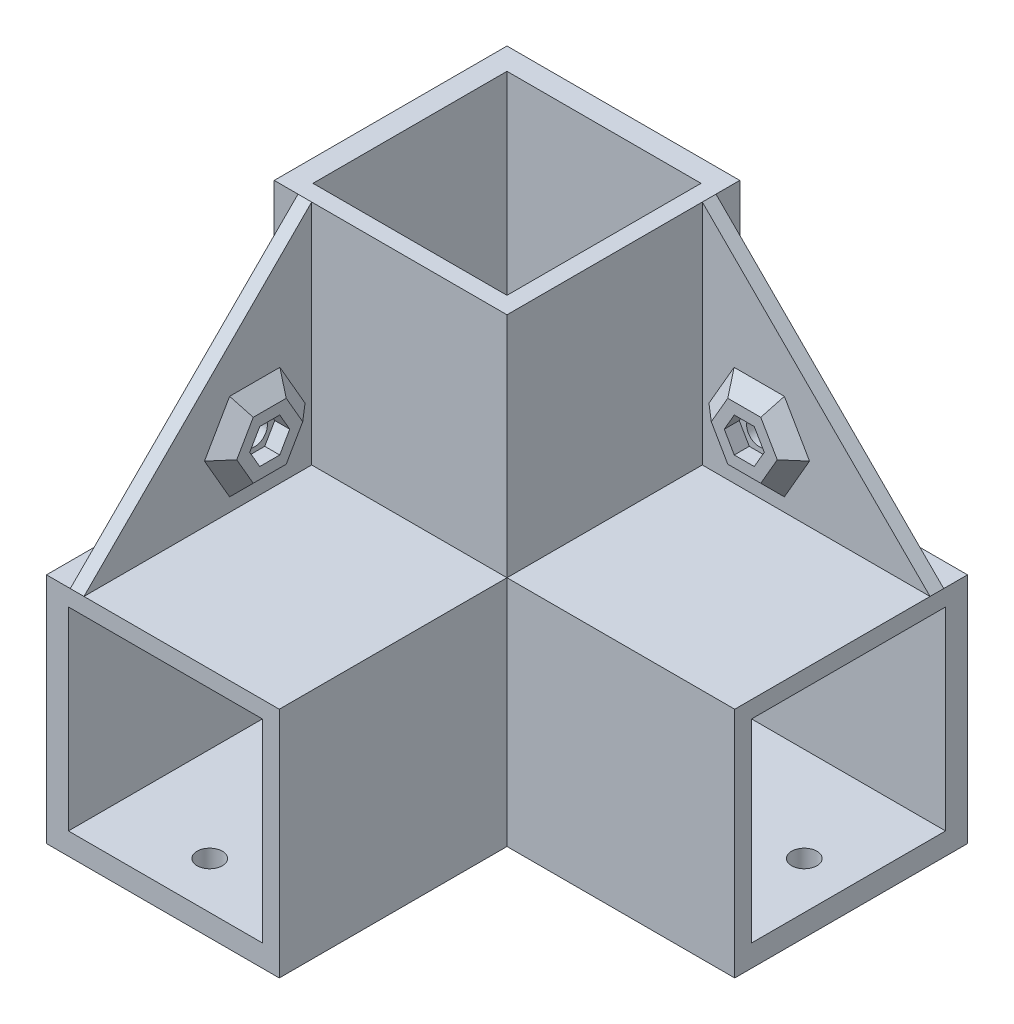
from build123d import *

# Parameters (mm, degrees)
ESQUISSE1_W                                       = 121.6
ESQUISSE1_H                                       = 121.6
BOSS_EXTRU_1_DEPTH                                = 60.8
ESQUISSE2_W                                       = 60.8
ESQUISSE2_H                                       = 60.8
ENL_V_MAT_EXTRU_1_DEPTH                           = 149.928976361
ESQUISSE3_W                                       = 60.8
ESQUISSE3_H                                       = 60.8
ENL_V_MAT_EXTRU_2_DEPTH                           = 106.3086891
ESQUISSE4_W                                       = 60.8
ESQUISSE4_H                                       = 60.8
ENL_V_MAT_EXTRU_3_DEPTH                           = 106.3086891
ESQUISSE5_W                                       = 51.8
ESQUISSE5_H                                       = 51.8
ENL_V_MAT_EXTRU_4_DEPTH                           = 60.8
ESQUISSE6_W                                       = 51.8
ESQUISSE6_H                                       = 51.8
ENL_V_MAT_EXTRU_5_DEPTH                           = 60.8
ESQUISSE7_W                                       = 51.8
ESQUISSE7_H                                       = 51.8
ENL_V_MAT_EXTRU_6_DEPTH                           = 60.8
BOSS_EXTRU_8_DEPTH                                = 1.35
BOSS_EXTRU_9_DEPTH                                = 1.35
FRAISAGE_POUR_VIS_T_TE_FRAIS_E_BOMB_E_D           = 4.3053
FRAISAGE_POUR_VIS_T_TE_FRAIS_E_BOMB_E_DEPTH       = 20
FRAISAGE_POUR_VIS_T_TE_FRAIS_E_BOMB_E_CSINK_D     = 7.0866
FRAISAGE_POUR_VIS_T_TE_FRAIS_E_BOMB_E_CSINK_ANGLE = 82
FRAISAGE_POUR_VIS_T_TE_FRAIS_E_BOMB_E_TIP         = 1.293442612
FRAISAGE_POUR_VIS_T_TE_FRAIS_E_6_PAN_D            = 4.3053
FRAISAGE_POUR_VIS_T_TE_FRAIS_E_6_PAN_DEPTH        = 20
FRAISAGE_POUR_VIS_T_TE_FRAIS_E_6_PAN_CSINK_D      = 7.7978
FRAISAGE_POUR_VIS_T_TE_FRAIS_E_6_PAN_CSINK_ANGLE  = 82
FRAISAGE_POUR_VIS_T_TE_FRAIS_E_6_PAN_TIP          = 1.293442612
BOSS_EXTRU_3_DEPTH                                = 10
ENL_V_MAT_EXTRU_13_DEPTH                          = 6.35
BOSS_EXTRU_2_DEPTH                                = 10
ENL_V_MAT_EXTRU_12_DEPTH                          = 6.35
D_GAGEMENT_1_42_D                                 = 6.7564
D_GAGEMENT_1_42_DEPTH                             = 20
D_GAGEMENT_1_42_TIP                               = 2.029827343
D_GAGEMENT_1_43_D                                 = 6.7564
D_GAGEMENT_1_43_DEPTH                             = 20
D_GAGEMENT_1_43_TIP                               = 2.029827343
BOSS_EXTRU_5_DEPTH                                = 4
CHANFREIN3_SIZE                                   = 4
BOSS_EXTRU_6_DEPTH                                = 4
CHANFREIN4_SIZE                                   = 4
BOSS_EXTRU_7_DEPTH                                = 1.35
D_GAGEMENT_1_44_D                                 = 6.7564
D_GAGEMENT_1_44_DEPTH                             = 20
D_GAGEMENT_1_44_TIP                               = 2.029827343
CHANFREIN1_START                                  = -109
CHANFREIN1_OUTLINE_W                              = 76
CHANFREIN1_OUTLINE_H                              = 88
CHANFREIN1_DEPTH                                  = 35.994058461


with BuildPart() as part:
    # Esquisse1 → Boss.-Extru.1 (new, symmetric)
    with BuildSketch(Plane.XY):
        Rectangle(ESQUISSE1_W, ESQUISSE1_H)
    extrude(amount=BOSS_EXTRU_1_DEPTH, both=True)

    # Esquisse2 → Enlèv. mat.-Extru.1 (cut, through all)
    with BuildSketch(Plane.XY.offset(60.8)):
        with Locations((30.4, 30.4)):
            Rectangle(ESQUISSE2_W, ESQUISSE2_H)
    extrude(amount=-ENL_V_MAT_EXTRU_1_DEPTH, mode=Mode.SUBTRACT)

    # Esquisse3 → Enlèv. mat.-Extru.2 (cut, through all)
    with BuildSketch(Plane(origin=(0, 0, 0), x_dir=(0, 0, -1), z_dir=(1, 0, 0))):
        with Locations((-30.4, 30.4)):
            Rectangle(ESQUISSE3_W, ESQUISSE3_H)
    extrude(amount=-ENL_V_MAT_EXTRU_2_DEPTH, mode=Mode.SUBTRACT)

    # Esquisse4 → Enlèv. mat.-Extru.3 (cut, through all)
    with BuildSketch(Plane(origin=(0, 0, 0), x_dir=(1, 0, 0), z_dir=(0, 1, 0))):
        with Locations((30.4, -30.4)):
            Rectangle(ESQUISSE4_W, ESQUISSE4_H)
    extrude(amount=-ENL_V_MAT_EXTRU_3_DEPTH, mode=Mode.SUBTRACT)

    # Esquisse5 → Enlèv. mat.-Extru.4 (cut)
    with BuildSketch(Plane.XY.offset(60.8)):
        with Locations((-30.4, -30.4)):
            Rectangle(ESQUISSE5_W, ESQUISSE5_H)
    extrude(amount=-ENL_V_MAT_EXTRU_4_DEPTH, mode=Mode.SUBTRACT)

    # Esquisse6 → Enlèv. mat.-Extru.5 (cut)
    with BuildSketch(Plane(origin=(60.8, 0, 0), x_dir=(0, 0, -1), z_dir=(1, 0, 0))):
        with Locations((30.4, -30.4)):
            Rectangle(ESQUISSE6_W, ESQUISSE6_H)
    extrude(amount=-ENL_V_MAT_EXTRU_5_DEPTH, mode=Mode.SUBTRACT)

    # Esquisse7 → Enlèv. mat.-Extru.6 (cut)
    with BuildSketch(Plane(origin=(0, 60.8, 0), x_dir=(1, 0, 0), z_dir=(0, 1, 0))):
        with Locations((-30.4, 30.4)):
            Rectangle(ESQUISSE7_W, ESQUISSE7_H)
    extrude(amount=-ENL_V_MAT_EXTRU_6_DEPTH, mode=Mode.SUBTRACT)

    # Esquisse40 → Boss.-Extru.8 (add)
    with BuildSketch(Plane.ZY.offset(60.8)):
        Polygon((0, 0), (0, 60.8), (-60.8, 60.8), (-60.8, -60.8), (60.8, -60.8), (60.8, 0), align=None)
    extrude(amount=BOSS_EXTRU_8_DEPTH)

    # Esquisse41 → Boss.-Extru.9 (add)
    with BuildSketch(Plane(origin=(0, 0, -60.8), x_dir=(-1, 0, 0), z_dir=(0, 0, -1))):
        Polygon((0, 0), (-60.8, 0), (-60.8, -60.8), (62.15, -60.8), (62.15, 60.8), (0, 60.8), align=None)
    extrude(amount=BOSS_EXTRU_9_DEPTH)

    # Fraisage pour vis à tête fraisée bombée #61
    with Locations(Plane(origin=(0, 0, -62.15), x_dir=(-1, 0, 0), z_dir=(0, 0, -1))):
        with Locations((-30.4, -30.4), (30.4, 30.4)):
            CounterSinkHole(FRAISAGE_POUR_VIS_T_TE_FRAIS_E_BOMB_E_D / 2, FRAISAGE_POUR_VIS_T_TE_FRAIS_E_BOMB_E_CSINK_D / 2, depth=FRAISAGE_POUR_VIS_T_TE_FRAIS_E_BOMB_E_DEPTH, counter_sink_angle=FRAISAGE_POUR_VIS_T_TE_FRAIS_E_BOMB_E_CSINK_ANGLE)
            with Locations((0, 0, -(FRAISAGE_POUR_VIS_T_TE_FRAIS_E_BOMB_E_DEPTH + FRAISAGE_POUR_VIS_T_TE_FRAIS_E_BOMB_E_TIP / 2))):  # 118° drill point
                Cone(0, FRAISAGE_POUR_VIS_T_TE_FRAIS_E_BOMB_E_D / 2, FRAISAGE_POUR_VIS_T_TE_FRAIS_E_BOMB_E_TIP, mode=Mode.SUBTRACT)

    # Fraisage pour vis à tête fraisée à 6 pans creux #61
    with Locations(Plane.ZY.offset(62.15)):
        with Locations((30.4, -30.4), (-30.4, 30.4)):
            CounterSinkHole(FRAISAGE_POUR_VIS_T_TE_FRAIS_E_6_PAN_D / 2, FRAISAGE_POUR_VIS_T_TE_FRAIS_E_6_PAN_CSINK_D / 2, depth=FRAISAGE_POUR_VIS_T_TE_FRAIS_E_6_PAN_DEPTH, counter_sink_angle=FRAISAGE_POUR_VIS_T_TE_FRAIS_E_6_PAN_CSINK_ANGLE)
            with Locations((0, 0, -(FRAISAGE_POUR_VIS_T_TE_FRAIS_E_6_PAN_DEPTH + FRAISAGE_POUR_VIS_T_TE_FRAIS_E_6_PAN_TIP / 2))):  # 118° drill point
                Cone(0, FRAISAGE_POUR_VIS_T_TE_FRAIS_E_6_PAN_D / 2, FRAISAGE_POUR_VIS_T_TE_FRAIS_E_6_PAN_TIP, mode=Mode.SUBTRACT)

    # Esquisse21 → Boss.-Extru.3 (add)
    with BuildSketch(Plane(origin=(0, 0, -62.15), x_dir=(-1, 0, 0), z_dir=(0, 0, -1))):
        Polygon((0, 0), (-60.8, 0), (0, 60.8), align=None)
    extrude(amount=-BOSS_EXTRU_3_DEPTH)

    # Esquisse31 → Enlèv. mat.-Extru.13 (cut)
    with BuildSketch(Plane(origin=(0, 0, -62.15), x_dir=(-1, 0, 0), z_dir=(0, 0, -1))):
        Polygon((0, 60.8), (0, 0), (-60.8, 0), align=None)
    extrude(amount=-ENL_V_MAT_EXTRU_13_DEPTH, mode=Mode.SUBTRACT)

    # Esquisse17 → Boss.-Extru.2 (add)
    with BuildSketch(Plane.ZY.offset(62.15)):
        Polygon((0, 0), (60.8, 0), (0, 60.8), align=None)
    extrude(amount=-BOSS_EXTRU_2_DEPTH)

    # Esquisse26 → Enlèv. mat.-Extru.12 (cut)
    with BuildSketch(Plane.ZY.offset(62.15)):
        Polygon((0, 60.8), (0, 0), (60.8, 0), align=None)
    extrude(amount=-ENL_V_MAT_EXTRU_12_DEPTH, mode=Mode.SUBTRACT)

    # Dégagement 1/42
    with Locations(Plane.ZY.offset(55.8)):
        with Locations((15.2, 15.2)):
            Hole(D_GAGEMENT_1_42_D / 2, depth=D_GAGEMENT_1_42_DEPTH)
            with Locations((0, 0, -(D_GAGEMENT_1_42_DEPTH + D_GAGEMENT_1_42_TIP / 2))):  # 118° drill point
                Cone(0, D_GAGEMENT_1_42_D / 2, D_GAGEMENT_1_42_TIP, mode=Mode.SUBTRACT)

    # Dégagement 1/43
    with Locations(Plane(origin=(0, 0, -55.8), x_dir=(-1, 0, 0), z_dir=(0, 0, -1))):
        with Locations((-15.2, 15.2)):
            Hole(D_GAGEMENT_1_43_D / 2, depth=D_GAGEMENT_1_43_DEPTH)
            with Locations((0, 0, -(D_GAGEMENT_1_43_DEPTH + D_GAGEMENT_1_43_TIP / 2))):  # 118° drill point
                Cone(0, D_GAGEMENT_1_43_D / 2, D_GAGEMENT_1_43_TIP, mode=Mode.SUBTRACT)

    # Esquisse30 → Boss.-Extru.5 (add)
    with BuildSketch(Plane(origin=(-52.15, 0, 0), x_dir=(0, 0, -1), z_dir=(1, 0, 0))):
        Polygon((-6.395408395, 15.2), (-10.797704197, 22.825), (-19.602295803, 22.825), (-24.004591605, 15.2), (-19.602295803, 7.575), (-10.797704197, 7.575), align=None)
        Polygon((-9.85951001, 15.2), (-12.529755005, 19.825), (-17.870244995, 19.825), (-20.54048999, 15.2), (-17.870244995, 10.575), (-12.529755005, 10.575), align=None, mode=Mode.SUBTRACT)
    extrude(amount=BOSS_EXTRU_5_DEPTH)

    # Chanfrein3
    chanfrein3_edges = [part.edges().sort_by_distance(p)[0] for p in [
        (-52.15, 7.575, 15.2),
        (-52.15, 11.3875, 8.596556296),
        (-52.15, 19.0125, 8.596556296),
        (-52.15, 22.825, 15.2),
        (-52.15, 11.3875, 21.803443704),
        (-52.15, 19.0125, 21.803443704),
    ]]
    chamfer(chanfrein3_edges, length=CHANFREIN3_SIZE - 0.0001)  # a hair under: the kernel refuses the full size

    # Esquisse36 → Boss.-Extru.6 (add)
    with BuildSketch(Plane.XY.offset(-52.15)):
        Polygon((19.602295803, 22.825), (10.797704197, 22.825), (6.395408395, 15.2), (10.797704197, 7.575), (19.602295803, 7.575), (24.004591605, 15.2), align=None)
        Polygon((20.54048999, 15.2), (17.870244995, 19.825), (12.529755005, 19.825), (9.85951001, 15.2), (12.529755005, 10.575), (17.870244995, 10.575), align=None, mode=Mode.SUBTRACT)
    extrude(amount=BOSS_EXTRU_6_DEPTH)

    # Chanfrein4
    chanfrein4_edges = [part.edges().sort_by_distance(p)[0] for p in [
        (8.596556296, 11.3875, -52.15),
        (8.596556296, 19.0125, -52.15),
        (15.2, 7.575, -52.15),
        (21.803443704, 11.3875, -52.15),
        (21.803443704, 19.0125, -52.15),
        (15.2, 22.825, -52.15),
    ]]
    chamfer(chanfrein4_edges, length=CHANFREIN4_SIZE - 0.0001)  # a hair under: the kernel refuses the full size

    # Esquisse39 → Boss.-Extru.7 (add)
    with BuildSketch(Plane.XZ.offset(60.8)):
        Polygon((-62.15, 60.8), (-62.15, -62.15), (60.8, -62.15), (60.8, 0), (0, 0), (0, 60.8), align=None)
    extrude(amount=BOSS_EXTRU_7_DEPTH)

    # Dégagement 1/44
    with Locations(Plane(origin=(0, -62.15, 0), x_dir=(-1, 0, 0), z_dir=(0, -1, 0))):
        with Locations((-48.3, 31.075), (31.075, -48.3)):
            Hole(D_GAGEMENT_1_44_D / 2, depth=D_GAGEMENT_1_44_DEPTH)
            with Locations((0, 0, -(D_GAGEMENT_1_44_DEPTH + D_GAGEMENT_1_44_TIP / 2))):  # 118° drill point
                Cone(0, D_GAGEMENT_1_44_D / 2, D_GAGEMENT_1_44_TIP, mode=Mode.SUBTRACT)

    # Chanfrein1: read off the stored shape, not the designer's step
    # Chanfrein1 outline → Chanfrein1 (cut)
    with BuildSketch(Plane(origin=(0, 0, 0), x_dir=(0.8164965809277258, -0.40824829046386313, -0.40824829046386313), z_dir=(0.5773502691896258, 0.5773502691896258, 0.5773502691896258)).offset(CHANFREIN1_START)):
        with Locations((12, 0)):
            Rectangle(CHANFREIN1_OUTLINE_W, CHANFREIN1_OUTLINE_H)
    extrude(amount=CHANFREIN1_DEPTH, mode=Mode.SUBTRACT)


solid = part.part
